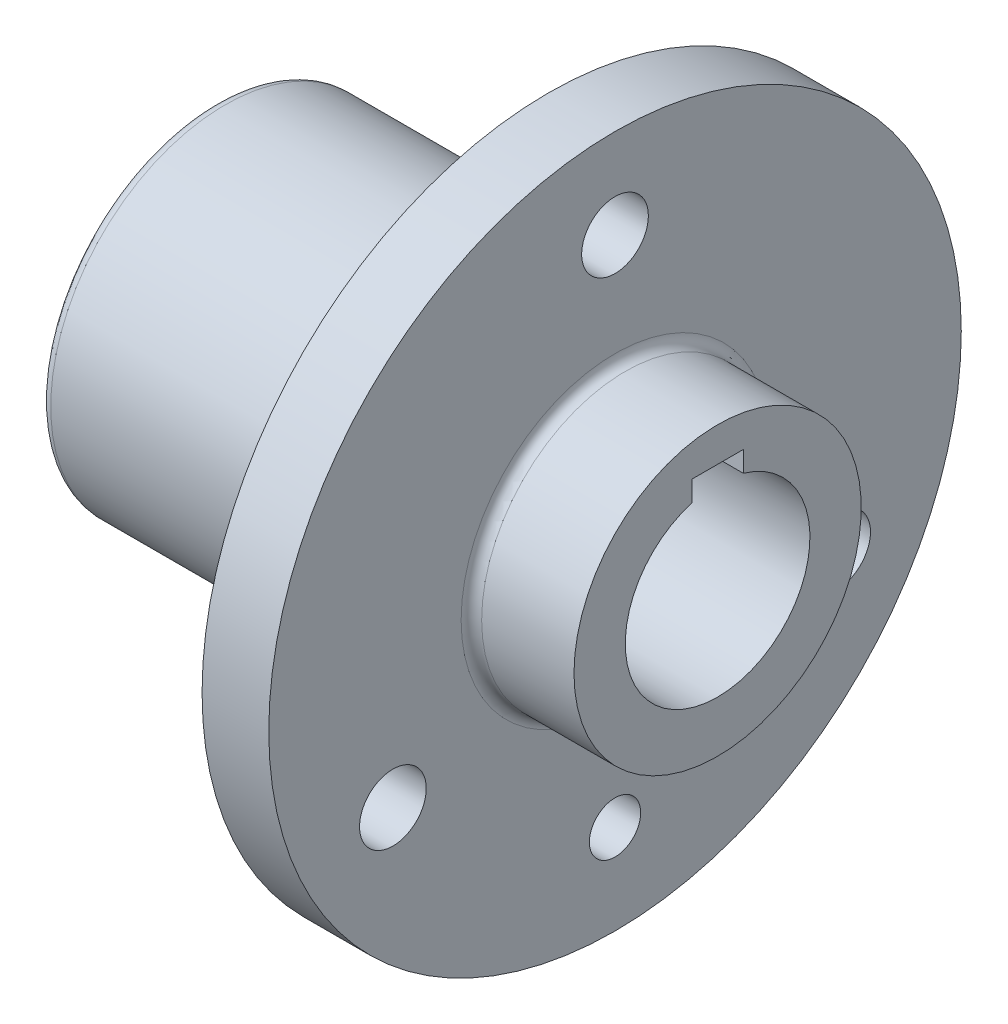
from build123d import *

# Parameters (mm, degrees)
FILLET1_R          = 2
FILLET2_R          = 2
SKETCH2_W          = 10
SKETCH2_H          = 6.6
CUT_EXTRUDE1_DEPTH = 52
SKETCH3_R          = 6.5
SKETCH3_R_2        = 5
CUT_EXTRUDE2_DEPTH = 52


with BuildPart() as part:
    # Sketch1 → Revolve1 (revolve)
    with BuildSketch(Plane.XY):
        Polygon((-48.746583118, 0), (-48.746583118, 5), (-43.746583118, 5), (-43.746583118, 24), (21.253416882, 24), (21.253416882, 57.5), (34.253416882, 57.5), (34.253416882, 18), (54.253416882, 18), (54.253416882, 8), (2.253416882, 8), (2.253416882, 14), (-33.746583118, 14), (-33.746583118, 3), (-36.746583118, 0), align=None)
    revolve(axis=Axis((-48.746583118, -10, 0), (1, 0, 0)))

    # Fillet1
    fillet1_edges = [part.edges().sort_by_distance(p)[0] for p in [
        (34.253416882, -38, 0),
        (21.253416882, -44, 0),
        (-43.746583118, -25, 0),
        (-43.746583118, -44, 0),
    ]]
    fillet(fillet1_edges, radius=FILLET1_R)

    # Fillet2
    fillet2_edges = [part.edges().sort_by_distance(p)[0] for p in [
        (2.253416882, -28, 0),
        (-33.746583118, -34, 0),
    ]]
    fillet(fillet2_edges, radius=FILLET2_R)

    # Sketch2 → Cut-Extrude1 (cut)
    with BuildSketch(Plane(origin=(54.253416882, 0, 0), x_dir=(0, 0, -1), z_dir=(1, 0, 0))):
        with Locations((0, 8)):
            Rectangle(SKETCH2_W, SKETCH2_H)
    extrude(amount=-CUT_EXTRUDE1_DEPTH, mode=Mode.SUBTRACT)

    # Sketch3 → Cut-Extrude2 (cut)
    with BuildSketch(Plane(origin=(34.253416882, 0, 0), x_dir=(0, 0, -1), z_dir=(1, 0, 0))):
        with Locations((0, 40)):
            Circle(SKETCH3_R)
        with Locations((43.301270189, -35)):
            Circle(SKETCH3_R)
        with Locations((-43.301270189, -35)):
            Circle(SKETCH3_R)
        with Locations((0, -60)):
            Circle(SKETCH3_R_2)
    extrude(amount=-CUT_EXTRUDE2_DEPTH, mode=Mode.SUBTRACT)


solid = part.part
